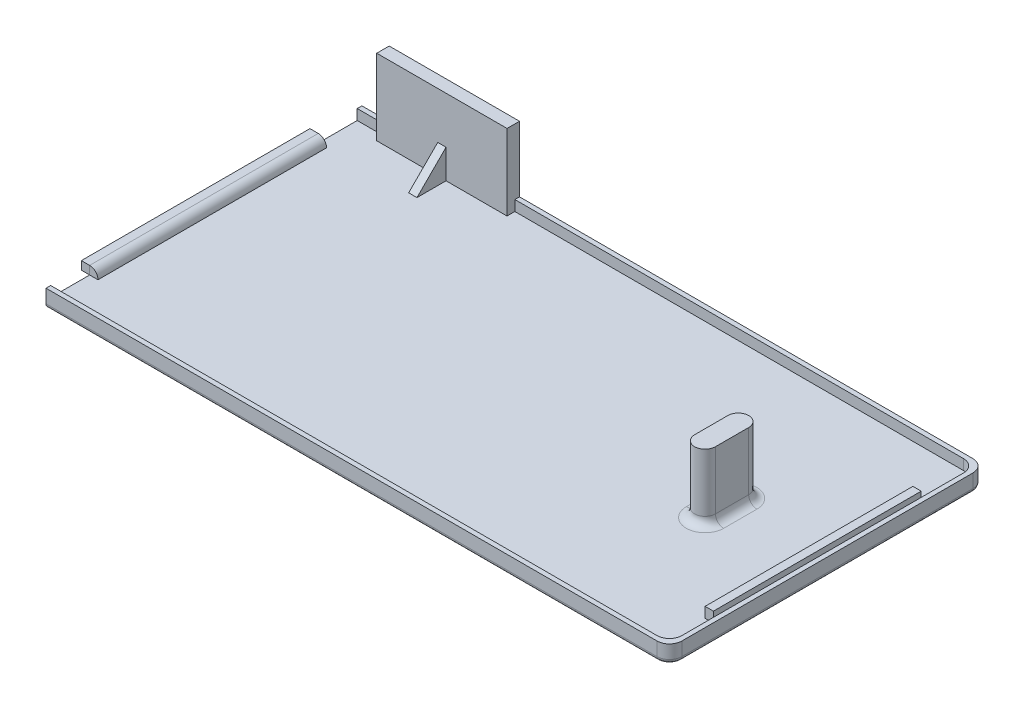
from build123d import *

# Parameters (mm, degrees)
BOSS_EXTRUDE1_DEPTH = 4.25
CUT_EXTRUDE1_DEPTH  = 2.5
SKETCH3_W           = 31.35
SKETCH3_H           = 3
BOSS_EXTRUDE2_DEPTH = 20
FILLET1_R           = 1
SWEEP1_START        = -65.5
SWEEP1_DEPTH        = 55
SKETCH6_W           = 2
SKETCH6_H           = 50
BOSS_EXTRUDE3_DEPTH = 2.5
RIB1_REACH          = 151.987
SKETCH7_WALL_W      = 311.873243788
SKETCH7_WALL_H      = 2
BOSS_EXTRUDE4_DEPTH = 16
FILLET2_R           = 2


# Read off the part's stored shape, not the designer's step: Sweep1
with BuildPart() as part:
    # Sketch1 → Boss-Extrude1 (new body)
    with BuildSketch(Plane(origin=(0, 0, 0), x_dir=(1, 0, 0), z_dir=(0, 1, 0))):
        with BuildLine():
            Line((0, 0), (147, 0))
            ThreePointArc((147, 0), (149.121320344, 0.878679656), (150, 3))
            Line((150, 3), (150, 73))
            ThreePointArc((150, 73), (149.121320344, 75.121320344), (147, 76))
            Line((147, 76), (0, 76))
            Line((0, 76), (0, 0))
        make_face()
    extrude(amount=BOSS_EXTRUDE1_DEPTH)

    # Sketch2 → Cut-Extrude1 (cut)
    with BuildSketch(Plane(origin=(0, 4.25, 0), x_dir=(1, 0, 0), z_dir=(0, 1, 0))):
        with BuildLine():
            Line((0, 74.875), (145.875, 74.875))
            ThreePointArc((145.875, 74.875), (147.996320344, 73.996320344), (148.875, 71.875))
            Line((148.875, 71.875), (148.875, 4.125))
            ThreePointArc((148.875, 4.125), (147.996320344, 2.003679656), (145.875, 1.125))
            Line((145.875, 1.125), (0, 1.125))
            Line((0, 1.125), (0, 74.875))
        make_face()
    extrude(amount=-CUT_EXTRUDE1_DEPTH, mode=Mode.SUBTRACT)

    # Sketch3 → Boss-Extrude2 (add)
    with BuildSketch(Plane(origin=(0, 0, 0), x_dir=(1, 0, 0), z_dir=(0, 1, 0))):
        with Locations((22.25, 74.5)):
            Rectangle(SKETCH3_W, SKETCH3_H)
    extrude(amount=BOSS_EXTRUDE2_DEPTH)

    # Fillet1
    fillet1_edges = [part.edges().sort_by_distance(p)[0] for p in [
        (73.5, 0, 0),
        (149.121320344, 0, -0.878679656),
        (150, 0, -38),
        (149.121320344, 0, -75.121320344),
        (73.5, 0, -76),
    ]]
    fillet(fillet1_edges, radius=FILLET1_R)

    # Sweep1 outline → Sweep1 (add)
    with BuildSketch(Plane.XY.offset(SWEEP1_START)):
        with BuildLine():
            Line((0, 3.75), (-2, 3.75))
            Line((-2, 3.75), (-2, 1.75))
            Line((-2, 1.75), (2, 1.75))
            ThreePointArc((2, 1.75), (1.414213562, 3.164213562), (0, 3.75))
        make_face()
    extrude(amount=SWEEP1_DEPTH)

    # Sketch6 → Boss-Extrude3 (add)
    with BuildSketch(Plane(origin=(0, 1.75, 0), x_dir=(1, 0, 0), z_dir=(0, 1, 0))):
        with Locations((146.575, 38)):
            Rectangle(SKETCH6_W, SKETCH6_H)
    extrude(amount=BOSS_EXTRUDE3_DEPTH)

    # Sketch7 wall → Rib1 (add, up to next)
    with BuildSketch(Plane(origin=(22.25, 5.25, -69.5), x_dir=(0, -0.707106781187, 0.707106781187), z_dir=(0, 0.707106781187, 0.707106781187)), mode=Mode.PRIVATE) as rib1_sk1:
        Rectangle(SKETCH7_WALL_W, SKETCH7_WALL_H)
    rib1_tool1 = extrude(rib1_sk1.sketch, amount=-RIB1_REACH, mode=Mode.PRIVATE) - part.part
    add(rib1_tool1.solids().sort_by_distance((22.25, 5.25, -69.5))[0])

    # Sketch8 → Boss-Extrude4 (add)
    with BuildSketch(Plane(origin=(0, 1.75, 0), x_dir=(1, 0, 0), z_dir=(0, 1, 0))):
        with BuildLine():
            Line((127.05753899, 42), (127.05753899, 34))
            ThreePointArc((127.05753899, 34), (124.55753899, 31.5), (122.05753899, 34))
            Line((122.05753899, 34), (122.05753899, 42))
            ThreePointArc((122.05753899, 42), (124.55753899, 44.5), (127.05753899, 42))
        make_face()
    extrude(amount=BOSS_EXTRUDE4_DEPTH)

    # Fillet2
    fillet2_edges = [part.edges().sort_by_distance(p)[0] for p in [
        (124.55753899, 1.75, -44.5),
        (122.05753899, 1.75, -38),
        (124.55753899, 1.75, -31.5),
        (127.05753899, 1.75, -38),
    ]]
    fillet(fillet2_edges, radius=FILLET2_R)


solid = part.part
